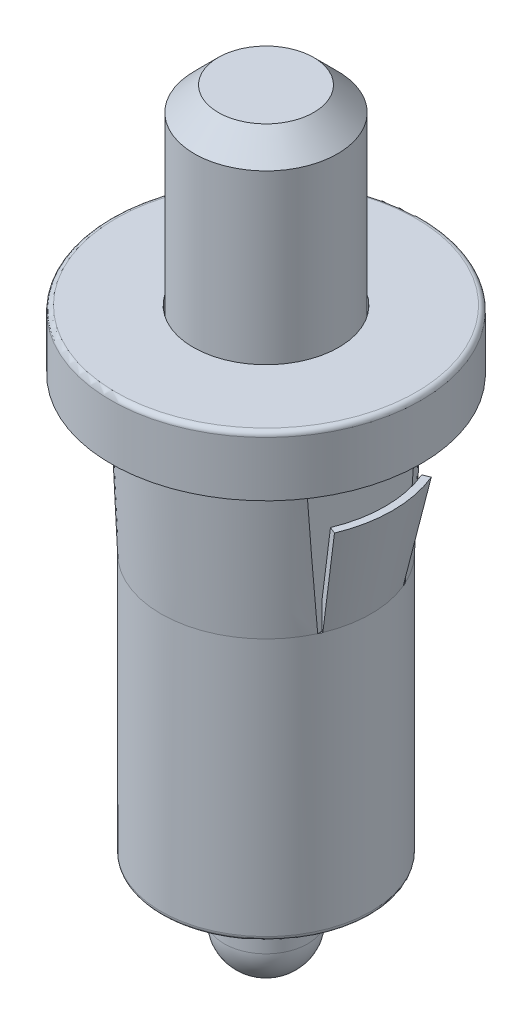
from build123d import *

# Parameters (mm, degrees)
FILLET1_R           = 0.2
CUT_EXTRUDE1_DEPTH  = 5
REVOLVE2_ANGLE      = 45.000276
SKETCH4_R           = 3.05
CUT_EXTRUDE2_DEPTH  = 10
SKETCH5_R           = 3
BOSS_EXTRUDE1_DEPTH = 18
CHAMFER1_SIZE       = 1
SKETCH6_R           = 1.8
CUT_EXTRUDE3_DEPTH  = 5
SKETCH7_R           = 1.75
BOSS_EXTRUDE2_DEPTH = 9
FILLET2_R           = 1.7
SKETCH8_W           = 0.3
SKETCH8_H           = 0.75


# Read off the part's stored shape, not the designer's step: Revolve2
with BuildPart() as part:
    # Sketch1 → Revolve1 (revolve)
    with BuildSketch(Plane.XY):
        Polygon((0, 0), (-4.4, 0), (-4.4, 11), (-4.65, 17.5), (-6.5, 17.5), (-6.5, 20), (0, 20), align=None)
    revolve(axis=Axis((0, 20, 0), (0, -1, 0)))

    # Fillet1
    fillet1_edges = [part.edges().sort_by_distance(p)[0] for p in [
        (6.5, 20, 0),
        (4.4, 0, 0),
    ]]
    fillet(fillet1_edges, radius=FILLET1_R)

    # Sketch2 → Cut-Extrude1 (cut, symmetric)
    with BuildSketch(Plane.XY):
        Polygon((-4, 11), (-4, 17.3), (-4.642307692, 17.3), (-4.4, 11), align=None)
        Polygon((4.4, 11), (4, 11), (4, 17.3), (4.642307692, 17.3), align=None)
    extrude(amount=CUT_EXTRUDE1_DEPTH, both=True, mode=Mode.SUBTRACT)

    # Revolve2 outline → Revolve2 (revolve)
    with BuildSketch(Plane(origin=(0, 0, 0), x_dir=(-0.923879239596717, 0, -0.3826841395226511), z_dir=(0.3826841395226511, 0, -0.923879239596717))):
        Polygon((4.4, 12.42897871), (4.093159214, 10.999987589), (4.4, 10.999987589), align=None)
        Polygon((4.995008841, 15.2), (4.4, 12.42897871), (4.4, 10.999987589), (5.301846962, 15.2), align=None)
    revolve2 = revolve(axis=Axis((0, 0, 0), (0, 1, 0)), revolution_arc=REVOLVE2_ANGLE)

    # Mirror1: Revolve2 across plane
    add(revolve2.mirror(Plane(origin=(0, 0, 0), x_dir=(0, 0, 1), z_dir=(1, 0, 0))))

    # Sketch4 → Cut-Extrude2 (cut)
    with BuildSketch(Plane(origin=(0, 20, 0), x_dir=(1, 0, 0), z_dir=(0, 1, 0))):
        with Locations(Location((0, 0, 0), (0, 0, 270))):
            Circle(SKETCH4_R)
    extrude(amount=-CUT_EXTRUDE2_DEPTH, mode=Mode.SUBTRACT)

    # Sketch6 → Cut-Extrude3 (cut)
    with BuildSketch(Plane(origin=(0, 0, 0), x_dir=(-1, 0, 0), z_dir=(0, -1, 0))):
        with Locations(Location((0, 0, 0), (0, 0, 180))):
            Circle(SKETCH6_R)
    extrude(amount=-CUT_EXTRUDE3_DEPTH, mode=Mode.SUBTRACT)

    # Sketch7 → Boss-Extrude2 (add)
    with BuildSketch(Plane(origin=(0, 5, 0), x_dir=(-1, 0, 0), z_dir=(0, -1, 0))):
        with Locations(Location((0, 0, 0), (0, 0, 180))):
            Circle(SKETCH7_R)
    extrude(amount=BOSS_EXTRUDE2_DEPTH)

    # Fillet2
    fillet2_edges = [part.edges().sort_by_distance(p)[0] for p in [
        (-1.75, -4, 0),
    ]]
    fillet(fillet2_edges, radius=FILLET2_R)

    # Sketch8 → Cut-Revolve1 (revolve, cut)
    with BuildSketch(Plane.XY, mode=Mode.PRIVATE) as cut_revolve1_sk:
        with Locations((-1.6, -1.125)):
            Rectangle(SKETCH8_W, SKETCH8_H)
    revolve(cut_revolve1_sk.sketch.rotate(Axis((0, 0, 0), (0, -1, 0)), 270), axis=Axis((0, 0, 0), (0, -1, 0)), mode=Mode.SUBTRACT)


with BuildPart() as body_2:
    # Sketch5 → Boss-Extrude1 (new body)
    with BuildSketch(Plane(origin=(0, 10, 0), x_dir=(1, 0, 0), z_dir=(0, 1, 0))):
        with Locations(Location((0, 0, 0), (0, 0, 270))):
            Circle(SKETCH5_R)
    extrude(amount=BOSS_EXTRUDE1_DEPTH)

    # Chamfer1
    chamfer1_edges = [body_2.edges().sort_by_distance(p)[0] for p in [
        (0, 28, -3),
    ]]
    chamfer(chamfer1_edges, length=CHAMFER1_SIZE)


solid = Compound([part.part, body_2.part])
